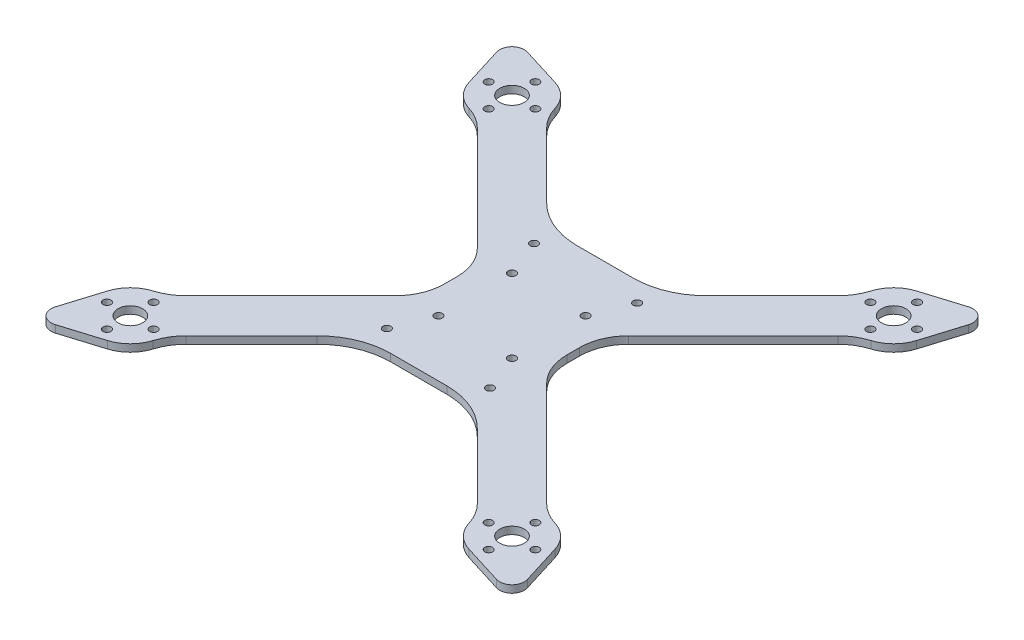
from build123d import *

# Parameters (mm, degrees)
SKETCH1_R           = 1.6
SKETCH1_R_2         = 5
BOSS_EXTRUDE1_DEPTH = 3


with BuildPart() as part:
    # Sketch1 → Boss-Extrude1 (new body)
    with BuildSketch(Plane(origin=(0, 0, 0), x_dir=(1, 0, 0), z_dir=(0, 1, 0))):
        with BuildLine():
            Line((-11.431457505, 38), (11.431457505, 38))
            ThreePointArc((11.431457505, 38), (22.911960476, 40.283614025), (32.644660941, 46.786796564))
            Line((32.644660941, 46.786796564), (59.39696962, 73.539105243))
            ThreePointArc((59.39696962, 73.539105243), (62.40469251, 77.391325759), (64.388311605, 81.858008551))
            ThreePointArc((64.388311605, 81.858008551), (67.860302459, 87.659243561), (73.646067483, 91.156952986))
            Line((73.646067483, 91.156952986), (89.941777265, 96.195664945))
            ThreePointArc((89.941777265, 96.195664945), (94.954339188, 94.954339188), (96.195664945, 89.941777265))
            Line((96.195664945, 89.941777265), (91.156952986, 73.646067483))
            ThreePointArc((91.156952986, 73.646067483), (87.659243561, 67.860302459), (81.858008551, 64.388311605))
            ThreePointArc((81.858008551, 64.388311605), (77.391325759, 62.40469251), (73.539105243, 59.39696962))
            Line((73.539105243, 59.39696962), (30.857864376, 16.715728753))
            ThreePointArc((30.857864376, 16.715728753), (26.52240935, 10.227261776), (25, 2.573593129))
            Line((25, 2.573593129), (25, -2.573593129))
            ThreePointArc((25, -2.573593129), (26.52240935, -10.227261776), (30.857864376, -16.715728753))
            Line((30.857864376, -16.715728753), (73.539105243, -59.39696962))
            ThreePointArc((73.539105243, -59.39696962), (77.391325759, -62.40469251), (81.858008551, -64.388311605))
            ThreePointArc((81.858008551, -64.388311605), (87.659243561, -67.860302459), (91.156952986, -73.646067483))
            Line((91.156952986, -73.646067483), (96.195664945, -89.941777265))
            ThreePointArc((96.195664945, -89.941777265), (94.954339188, -94.954339188), (89.941777265, -96.195664945))
            Line((89.941777265, -96.195664945), (73.646067483, -91.156952986))
            ThreePointArc((73.646067483, -91.156952986), (67.860302459, -87.659243561), (64.388311605, -81.858008551))
            ThreePointArc((64.388311605, -81.858008551), (62.40469251, -77.391325759), (59.39696962, -73.539105243))
            Line((59.39696962, -73.539105243), (32.644660941, -46.786796564))
            ThreePointArc((32.644660941, -46.786796564), (22.911960476, -40.283614025), (11.431457505, -38))
            Line((11.431457505, -38), (-11.431457505, -38))
            ThreePointArc((-11.431457505, -38), (-22.911960476, -40.283614025), (-32.644660941, -46.786796564))
            Line((-32.644660941, -46.786796564), (-59.39696962, -73.539105243))
            ThreePointArc((-59.39696962, -73.539105243), (-62.40469251, -77.391325759), (-64.388311605, -81.858008551))
            ThreePointArc((-64.388311605, -81.858008551), (-67.860302459, -87.659243561), (-73.646067483, -91.156952986))
            Line((-73.646067483, -91.156952986), (-89.941777265, -96.195664945))
            ThreePointArc((-89.941777265, -96.195664945), (-94.954339188, -94.954339188), (-96.195664945, -89.941777265))
            Line((-96.195664945, -89.941777265), (-91.156952986, -73.646067483))
            ThreePointArc((-91.156952986, -73.646067483), (-87.659243561, -67.860302459), (-81.858008551, -64.388311605))
            ThreePointArc((-81.858008551, -64.388311605), (-77.391325759, -62.40469251), (-73.539105243, -59.39696962))
            Line((-73.539105243, -59.39696962), (-30.857864376, -16.715728753))
            ThreePointArc((-30.857864376, -16.715728753), (-26.52240935, -10.227261776), (-25, -2.573593129))
            Line((-25, -2.573593129), (-25, 2.573593129))
            ThreePointArc((-25, 2.573593129), (-26.52240935, 10.227261776), (-30.857864376, 16.715728753))
            Line((-30.857864376, 16.715728753), (-73.539105243, 59.39696962))
            ThreePointArc((-73.539105243, 59.39696962), (-77.391325759, 62.40469251), (-81.858008551, 64.388311605))
            ThreePointArc((-81.858008551, 64.388311605), (-87.659243561, 67.860302459), (-91.156952986, 73.646067483))
            Line((-91.156952986, 73.646067483), (-96.195664945, 89.941777265))
            ThreePointArc((-96.195664945, 89.941777265), (-94.954339188, 94.954339188), (-89.941777265, 96.195664945))
            Line((-89.941777265, 96.195664945), (-73.646067483, 91.156952986))
            ThreePointArc((-73.646067483, 91.156952986), (-67.860302459, 87.659243561), (-64.388311605, 81.858008551))
            ThreePointArc((-64.388311605, 81.858008551), (-62.40469251, 77.391325759), (-59.39696962, 73.539105243))
            Line((-59.39696962, 73.539105243), (-32.644660941, 46.786796564))
            ThreePointArc((-32.644660941, 46.786796564), (-22.911960476, 40.283614025), (-11.431457505, 38))
        make_face()
        with Locations((77.781745931, 68.281745931)):
            Circle(SKETCH1_R, mode=Mode.SUBTRACT)
        with Locations((68.281745931, 77.781745931)):
            Circle(SKETCH1_R, mode=Mode.SUBTRACT)
        with Locations((77.781745931, 87.281745931)):
            Circle(SKETCH1_R, mode=Mode.SUBTRACT)
        with Locations((87.281745931, 77.781745931)):
            Circle(SKETCH1_R, mode=Mode.SUBTRACT)
        with Locations((77.781745931, -87.281745931)):
            Circle(SKETCH1_R, mode=Mode.SUBTRACT)
        with Locations((68.281745931, -77.781745931)):
            Circle(SKETCH1_R, mode=Mode.SUBTRACT)
        with Locations((77.781745931, -68.281745931)):
            Circle(SKETCH1_R, mode=Mode.SUBTRACT)
        with Locations((87.281745931, -77.781745931)):
            Circle(SKETCH1_R, mode=Mode.SUBTRACT)
        with Locations((15, 15)):
            Circle(SKETCH1_R, mode=Mode.SUBTRACT)
        with Locations((15, -15)):
            Circle(SKETCH1_R, mode=Mode.SUBTRACT)
        with Locations((77.781745931, 77.781745931)):
            Circle(SKETCH1_R_2, mode=Mode.SUBTRACT)
        with Locations((77.781745931, -77.781745931)):
            Circle(SKETCH1_R_2, mode=Mode.SUBTRACT)
        with Locations((-77.781745931, -77.781745931)):
            Circle(SKETCH1_R_2, mode=Mode.SUBTRACT)
        with Locations((-77.781745931, 77.781745931)):
            Circle(SKETCH1_R_2, mode=Mode.SUBTRACT)
        with Locations((-15, -15)):
            Circle(SKETCH1_R, mode=Mode.SUBTRACT)
        with Locations((-15, 15)):
            Circle(SKETCH1_R, mode=Mode.SUBTRACT)
        with Locations((-87.281745931, -77.781745931)):
            Circle(SKETCH1_R, mode=Mode.SUBTRACT)
        with Locations((-77.781745931, -68.281745931)):
            Circle(SKETCH1_R, mode=Mode.SUBTRACT)
        with Locations((-68.281745931, -77.781745931)):
            Circle(SKETCH1_R, mode=Mode.SUBTRACT)
        with Locations((-77.781745931, -87.281745931)):
            Circle(SKETCH1_R, mode=Mode.SUBTRACT)
        with Locations((-87.281745931, 77.781745931)):
            Circle(SKETCH1_R, mode=Mode.SUBTRACT)
        with Locations((-77.781745931, 87.281745931)):
            Circle(SKETCH1_R, mode=Mode.SUBTRACT)
        with Locations((-68.281745931, 77.781745931)):
            Circle(SKETCH1_R, mode=Mode.SUBTRACT)
        with Locations((-77.781745931, 68.281745931)):
            Circle(SKETCH1_R, mode=Mode.SUBTRACT)
        with Locations((-21, 30)):
            Circle(SKETCH1_R, mode=Mode.SUBTRACT)
        with Locations((-21, -30)):
            Circle(SKETCH1_R, mode=Mode.SUBTRACT)
        with Locations((21, -30)):
            Circle(SKETCH1_R, mode=Mode.SUBTRACT)
        with Locations((21, 30)):
            Circle(SKETCH1_R, mode=Mode.SUBTRACT)
    extrude(amount=BOSS_EXTRUDE1_DEPTH)


solid = part.part
